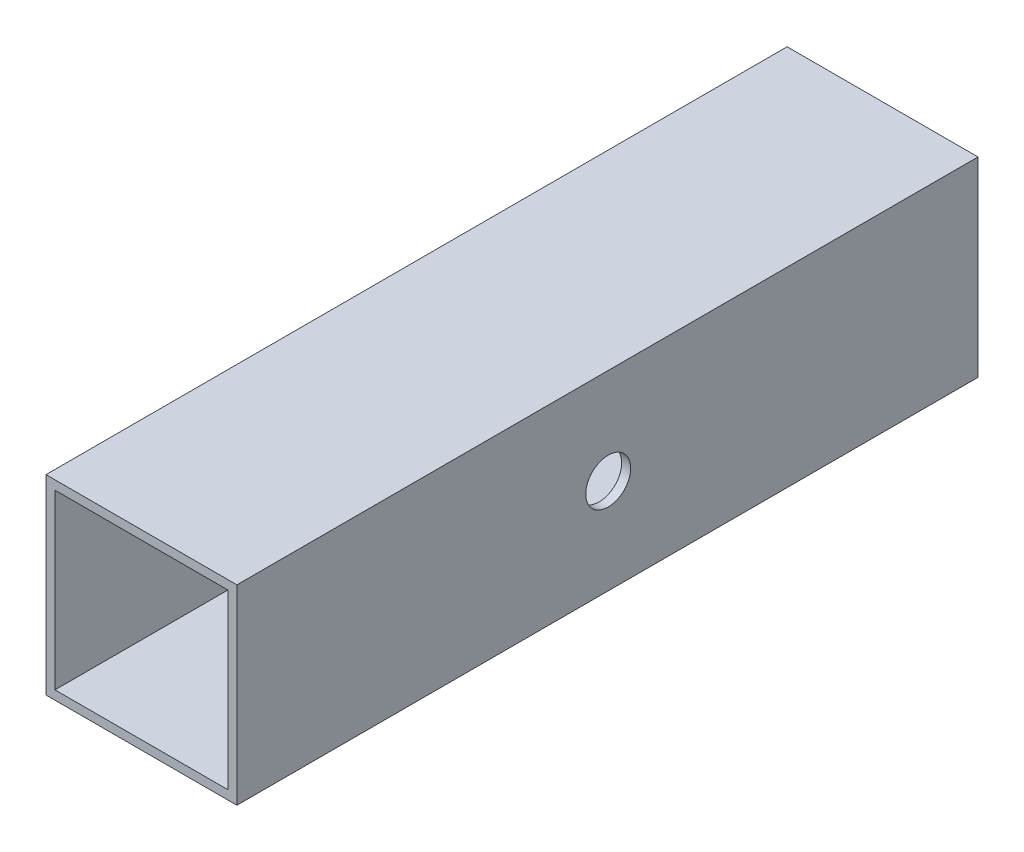
from build123d import *

# Parameters (mm, degrees)
SKETCH1_W                = 25.5
SKETCH1_H                = 25.5
SKETCH1_W_2              = 23.1
SKETCH1_H_2              = 23.1
BOSS_EXTRUDE1_DEPTH      = 99
F_6_0_6_DIAMETER_HOLE8_D = 6


with BuildPart() as part:
    # Sketch1 → Boss-Extrude1 (new body)
    with BuildSketch(Plane.XY):
        Rectangle(SKETCH1_W, SKETCH1_H)
        Rectangle(SKETCH1_W_2, SKETCH1_H_2, mode=Mode.SUBTRACT)
    extrude(amount=BOSS_EXTRUDE1_DEPTH)

    # Ø6.0 (6) Diameter Hole8 (through all)
    with Locations(Plane(origin=(12.75, 0, 0), x_dir=(0, 0, -1), z_dir=(1, 0, 0))):
        with Locations((-49.4, -0.05)):
            Hole(F_6_0_6_DIAMETER_HOLE8_D / 2)


solid = part.part
